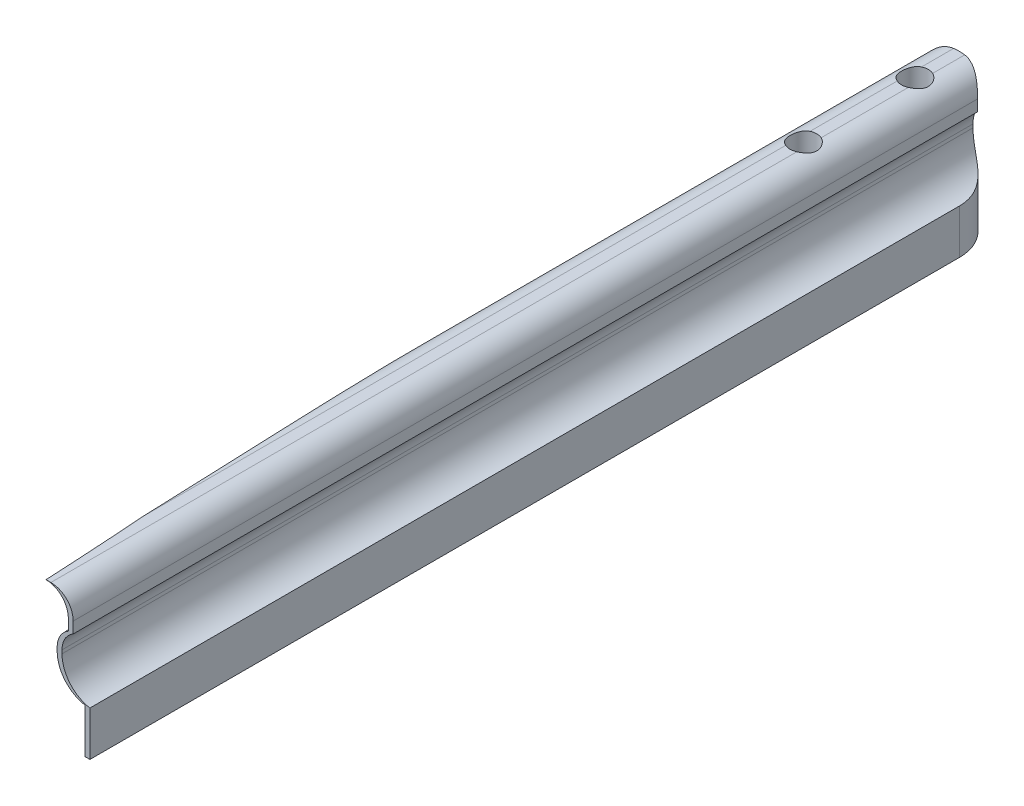
from build123d import *

# Parameters (mm, degrees)
SKETCH_1_W          = 4
SKETCH_1_H          = 17
SKETCH_1_H_2        = 8
EXTRUDE_1_DEPTH     = 4
SKETCH_1_7_W        = 44.5
SKETCH_1_7_H        = 8
EXTRUDE_2_DEPTH     = 3.5
SKETCH_2_W          = 18.5
SKETCH_2_H          = 1.5
CUT_EXTRUDE_1_DEPTH = 34.705526253
SKETCH_2_3_W        = 2.5
SKETCH_2_3_H        = 1.5
EXTRUDE_4_DEPTH     = 25
FILLET_1_R          = 1
FILLET_2_R          = 1.5
FILLET_3_R          = 1
SKETCH_10_W         = 4.5
SKETCH_10_H         = 8
SKETCH_10_W_2       = 36
SKETCH_10_H_2       = 50
CUT_EXTRUDE_2_DEPTH = 45.331845213
CUT_EXTRUDE_3_DEPTH = 43.252958476
SKETCH_12_W         = 4
SKETCH_12_H         = 50
CUT_EXTRUDE_4_DEPTH = 2
SKETCH_13_R         = 0.6
CUT_EXTRUDE_5_DEPTH = 42.920311452
SKETCH_24_R         = 0.6
CUT_EXTRUDE_6_DEPTH = 42.920311452
SKETCH_25_W         = 9.588346595
SKETCH_25_H         = 3.3
CUT_EXTRUDE_7_DEPTH = 42.920311452
SKETCH_26_W         = 7.846978632
SKETCH_26_H         = 7.676354821
CUT_EXTRUDE_8_DEPTH = 39.99618586
SKETCH_27_W         = 71.858666529
SKETCH_27_H         = 35.216616035
CUT_EXTRUDE_9_DEPTH = 35.515395273


with BuildPart() as part:
    # 草图1 → 凸台-拉伸1 (new body)
    with BuildSketch(Plane(origin=(0, 0, 0), x_dir=(1, 0, 0), z_dir=(0, 1, 0))):
        with Locations((-15.75, -4)):
            Rectangle(SKETCH_1_W, SKETCH_1_H)
        with Locations((15.75, -4)):
            Rectangle(SKETCH_1_W, SKETCH_1_H)
        with Locations((15.75, 8.5)):
            Rectangle(SKETCH_1_W, SKETCH_1_H_2)
        with Locations((-15.75, 8.5)):
            Rectangle(SKETCH_1_W, SKETCH_1_H_2)
    extrude(amount=EXTRUDE_1_DEPTH)

    # 草图1<7> → 凸台-拉伸2 (add)
    with BuildSketch(Plane(origin=(0, 0, 0), x_dir=(1, 0, 0), z_dir=(0, 1, 0))):
        with Locations((0, 8.5)):
            Rectangle(SKETCH_1_7_W, SKETCH_1_7_H)
    extrude(amount=EXTRUDE_2_DEPTH)

    # 草图2 → 切除-拉伸1 (cut, through all)
    with BuildSketch(Plane(origin=(0, 0, -12.5), x_dir=(-1, 0, 0), z_dir=(0, 0, -1))):
        with Locations((0, 2.75)):
            Rectangle(SKETCH_2_W, SKETCH_2_H)
        Polygon((13.25, 3.5), (9.25, 3.5), (9.25, 2), align=None)
        Polygon((-9.25, 3.5), (-13.25, 3.5), (-9.25, 2), align=None)
        Polygon((-22.25, 3.5), (-22.25, 2), (-18.25, 3.5), align=None)
        Polygon((22.25, 3.5), (18.25, 3.5), (22.25, 2), align=None)
    extrude(amount=-CUT_EXTRUDE_1_DEPTH, mode=Mode.SUBTRACT)

    # 草图2<3> → 凸台-拉伸4 (add, through all)
    with BuildSketch(Plane(origin=(0, 0, -12.5), x_dir=(-1, 0, 0), z_dir=(0, 0, -1))):
        with Locations((-15.75, 7.25)):
            Rectangle(SKETCH_2_3_W, SKETCH_2_3_H)
        Polygon((-15, 6.5), (-16.5, 6.5), (-16.5, 4), (-15.75, 4), (-15, 4), align=None)
        with Locations((15.75, 7.25)):
            Rectangle(SKETCH_2_3_W, SKETCH_2_3_H)
        Polygon((16.5, 6.5), (15, 6.5), (15, 4), (15.75, 4), (16.5, 4), align=None)
    extrude(amount=-EXTRUDE_4_DEPTH)

    # 圆角1
    # the kernel refuses this fillet: 1 mm, written as the material it adds along each edge
    with BuildSketch(Plane(origin=(-16.5, 6.5, -12.5), x_dir=(-1, 0, 0), z_dir=(0, 0, 1)), Plane(origin=(15, 6.5, -12.5), x_dir=(-1, 0, 0), z_dir=(0, 0, 1))) as fillet_1_piece_1:
        with BuildLine():
            CenterArc((1, 0.866025404), FILLET_1_R, 180, 60)
            Line((0, 0.866025404), (-0.02, 0.866025404))
            Line((-0.02, 0.866025404), (-0.02, 0))
            Line((-0.02, 0), (0, -0.02))
            ThreePointArc((0, -0.02), (0.25, -0.02), (0.49, -0.017320508))
            Line((0.49, -0.017320508), (0.5, 0))
        make_face()
    extrude(amount=25)
    with BuildSketch(Plane(origin=(-15, 6.5, -12.5), x_dir=(0, -1, 0), z_dir=(0, 0, 1)), Plane(origin=(16.5, 6.5, -12.5), x_dir=(0, -1, 0), z_dir=(0, 0, 1))) as fillet_1_piece_2:
        with BuildLine():
            CenterArc((0.866025404, 1), FILLET_1_R, 210, 60)
            Line((0, 0.5), (-0.017320508, 0.49))
            ThreePointArc((-0.017320508, 0.49), (-0.02, 0.25), (-0.02, 0))
            Line((-0.02, 0), (0, -0.02))
            Line((0, -0.02), (0.866025404, -0.02))
            Line((0.866025404, -0.02), (0.866025404, 0))
        make_face()
    extrude(amount=25)

    # 圆角2
    # the kernel refuses this fillet: 1.5 mm, written as the material it adds along each edge
    with BuildSketch(Plane(origin=(16.5, 4, -12.5), x_dir=(1, 0, 0), z_dir=(0, 0, 1))) as fillet_2_piece_1:
        with BuildLine():
            CenterArc((1.5, 1.479019946), FILLET_2_R, 180, 80.405931773)
            Line((0, 1.479019946), (-0.03, 1.479019946))
            Line((-0.03, 1.479019946), (-0.03, 0))
            Line((-0.03, 0), (0, -0.03))
            ThreePointArc((0, -0.03), (0.625, -0.03), (1.245, -0.029580399))
            Line((1.245, -0.029580399), (1.25, 0))
        make_face()
    extrude(amount=25)
    with BuildSketch(Plane(origin=(15, 4, -12.5), x_dir=(0, 1, 0), z_dir=(0, 0, 1)), Plane(origin=(-16.5, 4, -12.5), x_dir=(0, 1, 0), z_dir=(0, 0, 1))) as fillet_2_piece_2:
        with BuildLine():
            CenterArc((1.479019946, 1.5), FILLET_2_R, 189.594068227, 80.405931773)
            Line((0, 1.25), (-0.029580399, 1.245))
            ThreePointArc((-0.029580399, 1.245), (-0.03, 0.625), (-0.03, 0))
            Line((-0.03, 0), (0, -0.03))
            Line((0, -0.03), (1.479019946, -0.03))
            Line((1.479019946, -0.03), (1.479019946, 0))
        make_face()
    extrude(amount=25)
    with BuildSketch(Plane(origin=(-15, 4, -12.5), x_dir=(0, 1, 0), z_dir=(0, 0, 1))) as fillet_2_piece_3:
        with BuildLine():
            CenterArc((1.479019946, -1.5), FILLET_2_R, 90, 80.405931773)
            Line((0, -1.25), (-0.029580399, -1.245))
            ThreePointArc((-0.029580399, -1.245), (-0.03, -0.625), (-0.03, 0))
            Line((-0.03, 0), (0, 0.03))
            Line((0, 0.03), (1.479019946, 0.03))
            Line((1.479019946, 0.03), (1.479019946, 0))
        make_face()
    extrude(amount=25)

    # 圆角3
    fillet_3_edges = [part.edges().sort_by_distance(p)[0] for p in [
        (14.5, 8, 0),
        (17, 8, 0),
        (-17, 8, 0),
        (-14.5, 8, 0),
    ]]
    fillet(fillet_3_edges, radius=FILLET_3_R)

    # 镜向2: part across plane


with BuildPart() as part_1:
    add(part.part)
    add(part.part.mirror(Plane(origin=(0, 4, 12.5), x_dir=(1, 0, 0), z_dir=(0, 0, -1))))

    # 草图10 → 切除-拉伸2 (cut, through all)
    with BuildSketch(Plane.XZ):
        with Locations((-20, 33.5)):
            Rectangle(SKETCH_10_W, SKETCH_10_H)
        with Locations((-20, -8.5)):
            Rectangle(SKETCH_10_W, SKETCH_10_H)
        with Locations((4.25, 12.5)):
            Rectangle(SKETCH_10_W_2, SKETCH_10_H_2)
    extrude(amount=-CUT_EXTRUDE_2_DEPTH, mode=Mode.SUBTRACT)

    # 草图11 → 切除-拉伸3 (cut, through all)
    with BuildSketch(Plane(origin=(0, 0, 0), x_dir=(-1, 0, 0), z_dir=(0, -1, 0))):
        with BuildLine():
            ThreePointArc((15.75, 12.5), (17.164213562, 11.914213562), (17.75, 10.5))
            Line((17.75, 10.5), (17.75, 12.5))
            Line((17.75, 12.5), (15.75, 12.5))
        make_face()
        with BuildLine():
            ThreePointArc((13.75, 10.5), (14.335786438, 11.914213562), (15.75, 12.5))
            Line((15.75, 12.5), (13.75, 12.5))
            Line((13.75, 12.5), (13.75, 10.5))
        make_face()
    extrude(amount=-CUT_EXTRUDE_3_DEPTH, mode=Mode.SUBTRACT)

    # 草图12 → 切除-拉伸4 (cut)
    with BuildSketch(Plane.XZ):
        with Locations((-15.75, 12.5)):
            Rectangle(SKETCH_12_W, SKETCH_12_H)
    extrude(amount=-CUT_EXTRUDE_4_DEPTH, mode=Mode.SUBTRACT)

    # 草图13 → 切除-拉伸5 (cut, through all)
    with BuildSketch(Plane(origin=(0, 8, 0), x_dir=(1, 0, 0), z_dir=(0, 1, 0))):
        with Locations(Location((-15.75, 10.5, 0), (0, 0, 270))):
            Circle(SKETCH_13_R)
    extrude(amount=-CUT_EXTRUDE_5_DEPTH, mode=Mode.SUBTRACT)

    # 草图16 → 切除-旋转1 (revolve, cut)
    with BuildSketch(Plane.XY.offset(37.5)):
        with BuildLine():
            Line((-17.75, 0), (-13.75, 0))
            Line((-13.75, 0), (-13.75, 4))
            ThreePointArc((-13.75, 4), (-14.645643924, 4.510774109), (-15, 5.479019946))
            Line((-15, 5.479019946), (-15, 5.633974596))
            ThreePointArc((-15, 5.633974596), (-14.866025404, 6.133974596), (-14.5, 6.5))
            Line((-14.5, 6.5), (-14.5, 7))
            ThreePointArc((-14.5, 7), (-14.792893219, 7.707106781), (-15.5, 8))
            Line((-15.5, 8), (-16, 8))
            ThreePointArc((-16, 8), (-16.707106781, 7.707106781), (-17, 7))
            Line((-17, 7), (-17, 6.5))
            ThreePointArc((-17, 6.5), (-16.633974596, 6.133974596), (-16.5, 5.633974596))
            Line((-16.5, 5.633974596), (-16.5, 5.479019946))
            ThreePointArc((-16.5, 5.479019946), (-16.854356076, 4.510774109), (-17.75, 4))
            Line((-17.75, 4), (-17.75, 0))
        make_face()
    revolve(axis=Axis((169.25, 37.729395322, 37.5), (0, -1, 0)), mode=Mode.SUBTRACT)

    # 草图24 → 切除-拉伸6 (cut, through all)
    with BuildSketch(Plane(origin=(0, 2, 0), x_dir=(-1, 0, 0), z_dir=(0, -1, 0))):
        with Locations(Location((15.75, 5.5, 0), (0, 0, 90))):
            Circle(SKETCH_24_R)
    extrude(amount=-CUT_EXTRUDE_6_DEPTH, mode=Mode.SUBTRACT)

    # 草图25 → 切除-拉伸7 (cut, through all)
    with BuildSketch(Plane(origin=(0, 8, 0), x_dir=(1, 0, 0), z_dir=(0, 1, 0))):
        with Locations((-13.334902889, -35.85)):
            Rectangle(SKETCH_25_W, SKETCH_25_H)
    extrude(amount=-CUT_EXTRUDE_7_DEPTH, mode=Mode.SUBTRACT)

    # 草图26 → 切除-拉伸8 (cut, through all)
    with BuildSketch(Plane(origin=(0, 8, 0), x_dir=(1, 0, 0), z_dir=(0, 1, 0))):
        with Locations((-16.033810668, -32.338177411)):
            Rectangle(SKETCH_26_W, SKETCH_26_H)
    extrude(amount=-CUT_EXTRUDE_8_DEPTH, mode=Mode.SUBTRACT)


with BuildPart() as body_2:
    # 镜向3: mirrored copy
    add(part_1.part.mirror(Plane(origin=(0, 0, 0), x_dir=(0, 0, 1), z_dir=(1, 0, 0))))


with BuildPart() as part_2:
    add(part_1.part)

    # 草图27 → 切除-拉伸9 (cut, through all)
    with BuildSketch(Plane(origin=(0, 0, 0), x_dir=(0, 0, -1), z_dir=(1, 0, 0))):
        with Locations((-17.475525281, 10.465734061)):
            Rectangle(SKETCH_27_W, SKETCH_27_H)
    extrude(amount=-CUT_EXTRUDE_9_DEPTH, mode=Mode.SUBTRACT)


solid = body_2.part
